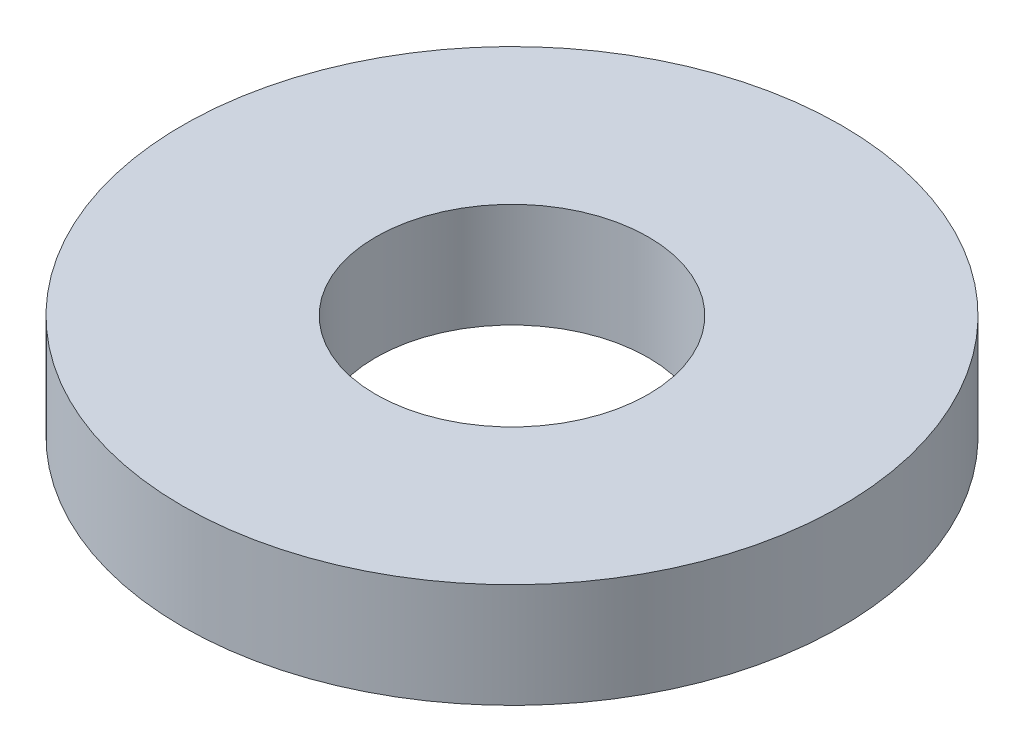
from build123d import *

# Parameters (mm, degrees)
SKETCH1_R           = 72.5
BOSS_EXTRUDE1_DEPTH = 23
SKETCH2_R           = 30
CUT_EXTRUDE1_DEPTH  = 106.078542053


with BuildPart() as part:
    # Sketch1 → Boss-Extrude1 (new body)
    with BuildSketch(Plane(origin=(0, 0, 0), x_dir=(1, 0, 0), z_dir=(0, 1, 0))):
        Circle(SKETCH1_R)
    extrude(amount=BOSS_EXTRUDE1_DEPTH)

    # Sketch2 → Cut-Extrude1 (cut, through all)
    with BuildSketch(Plane(origin=(0, 0, 0), x_dir=(1, 0, 0), z_dir=(0, 1, 0))):
        Circle(SKETCH2_R)
    extrude(amount=CUT_EXTRUDE1_DEPTH, mode=Mode.SUBTRACT)


solid = part.part
